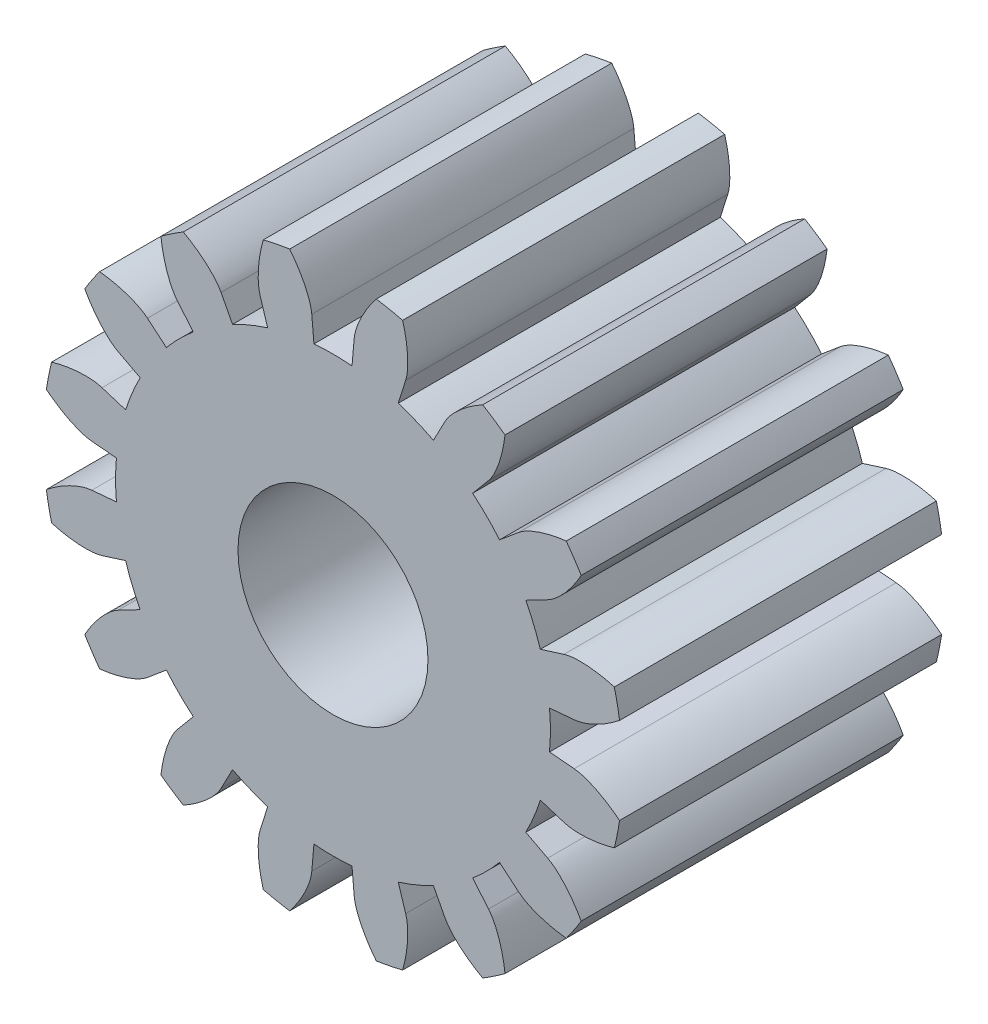
from build123d import *

# Parameters (mm, degrees)
SKETCH_1_R               = 4.5
SKETCH_1_R_2             = 1.475
EXTRUDE_1_DEPTH          = 5
CUT_EXTRUDE_1_DEPTH      = 9.093207028
PATTERN_CIRCULAR_1_COUNT = 16
PATTERN_CIRCULAR_1_ANGLE = 337.5


with BuildPart() as part:
    # 草图1 → 凸台-拉伸1 (new body)
    with BuildSketch(Plane.XY):
        Circle(SKETCH_1_R)
        Circle(SKETCH_1_R_2, mode=Mode.SUBTRACT)
    extrude(amount=EXTRUDE_1_DEPTH)

    # 草图1<3> → 切除-拉伸1 (cut, through all)
    with BuildSketch(Plane.XY):
        with BuildLine():
            Line((3.744337803, 0.329074401), (3.362040897, 0.295475903))
            ThreePointArc((3.362040897, 0.295475903), (3.371758668, 0.147879975), (3.375, 0))
            ThreePointArc((3.375, 0), (3.371758668, -0.147879975), (3.362040897, -0.295475903))
            Line((3.362040897, -0.295475903), (3.744337803, -0.329074401))
            add(Edge.make_bspline(
                [(3.744337803, -0.329074401), (3.772879878, -0.331582846), (3.852010051, -0.344515168), (3.998053748, -0.392622231), (4.176593354, -0.48016265), (4.319250266, -0.572875861), (4.413779393, -0.643953083), (4.449506423, -0.672229565)],
                knots=[0, 0, 0, 0, 0, 0.005604068, 0.015718248, 0.029959916, 0.038889728, 0.038889728, 0.038889728, 0.038889728, 0.038889728], degree=4))
            ThreePointArc((4.449506423, -0.672229565), (4.48735885, -0.337061637), (4.5, 0))
            ThreePointArc((4.5, 0), (4.48735885, 0.337061637), (4.449506423, 0.672229565))
            add(Edge.make_bspline(
                [(3.744337803, 0.329074401), (3.772879878, 0.331582846), (3.852010051, 0.344515168), (3.998053748, 0.392622231), (4.176593354, 0.48016265), (4.319250266, 0.572875861), (4.413779393, 0.643953083), (4.449506423, 0.672229565)],
                knots=[0, 0, 0, 0, 0, 0.005604068, 0.015718248, 0.029959916, 0.038889728, 0.038889728, 0.038889728, 0.038889728, 0.038889728], degree=4))
        make_face()
    cut_extrude_1 = extrude(amount=CUT_EXTRUDE_1_DEPTH, mode=Mode.SUBTRACT)

    # 阵列(圆周)1: 切除-拉伸1 ×16 about axis
    pattern_circular_1_axis = Axis((0, 0, 5), (0, 0, 1))
    for i in range(1, PATTERN_CIRCULAR_1_COUNT):
        add(cut_extrude_1.rotate(pattern_circular_1_axis, i * PATTERN_CIRCULAR_1_ANGLE / (PATTERN_CIRCULAR_1_COUNT - 1)), mode=Mode.SUBTRACT)


solid = part.part
